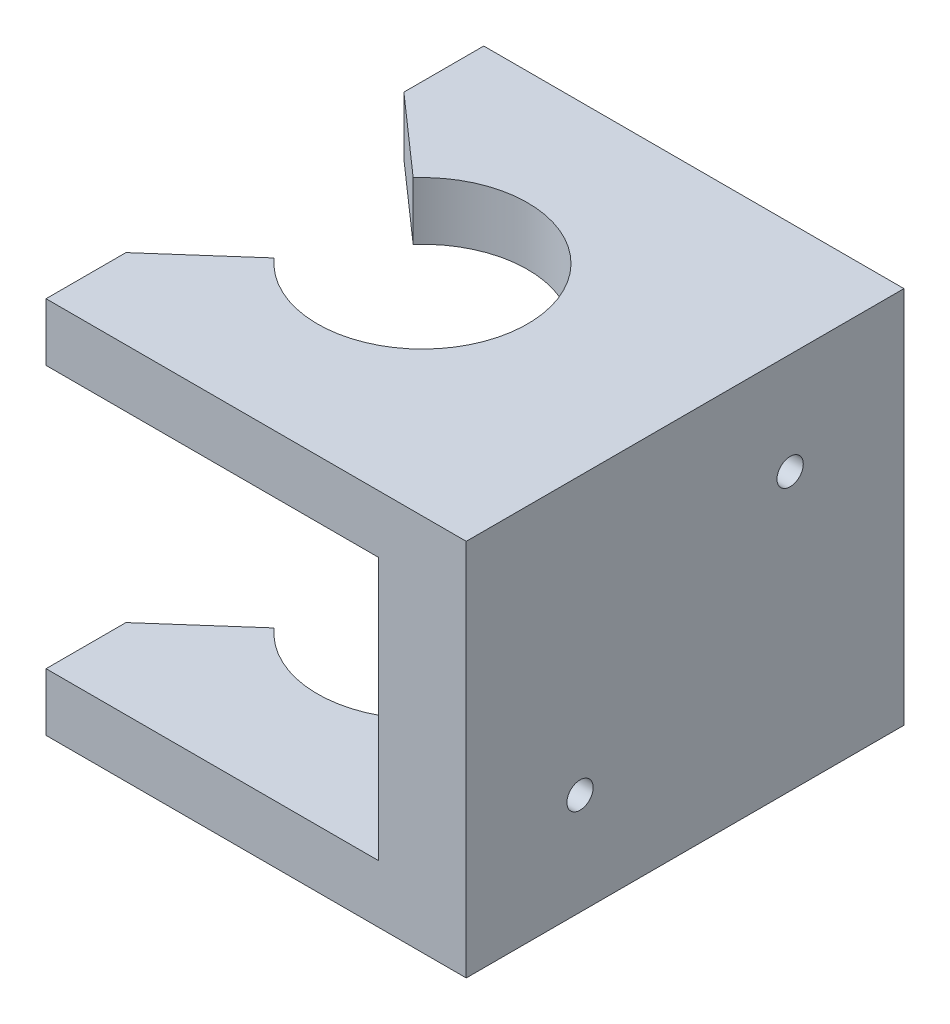
from build123d import *

# Parameters (mm, degrees)
BOSS_EXTRUDE1_DEPTH = 3.3
SKETCH3_W           = 5
SKETCH3_H           = 25
BOSS_EXTRUDE3_DEPTH = 15
BOSS_EXTRUDE4_DEPTH = 3.3
SKETCH5_R           = 0.75
CUT_EXTRUDE1_DEPTH  = 35.62383572


with BuildPart() as part:
    # Sketch2 → Boss-Extrude1 (new body)
    with BuildSketch(Plane(origin=(0, 0, 0), x_dir=(1, 0, 0), z_dir=(0, 1, 0))):
        with BuildLine():
            Line((15, -12.5), (-9, -12.5))
            Line((-9, -12.5), (-9, -7.937253933))
            Line((-9, -7.937253933), (-4.5, -3.968626967))
            ThreePointArc((-4.5, -3.968626967), (6, 0), (-4.5, 3.968626967))
            Line((-4.5, 3.968626967), (-9, 7.937253933))
            Line((-9, 7.937253933), (-9, 12.5))
            Line((-9, 12.5), (15, 12.5))
            Line((15, 12.5), (15, -12.5))
        make_face()
    extrude(amount=BOSS_EXTRUDE1_DEPTH)

    # Sketch3 → Boss-Extrude3 (add)
    with BuildSketch(Plane(origin=(0, 3.3, 0), x_dir=(1, 0, 0), z_dir=(0, 1, 0))):
        with Locations((12.5, 0)):
            Rectangle(SKETCH3_W, SKETCH3_H)
    extrude(amount=BOSS_EXTRUDE3_DEPTH)

    # Sketch4 → Boss-Extrude4 (add)
    with BuildSketch(Plane(origin=(0, 18.3, 0), x_dir=(1, 0, 0), z_dir=(0, 1, 0))):
        with BuildLine():
            Line((-9, -12.5), (15, -12.5))
            Line((15, -12.5), (15, 12.5))
            Line((15, 12.5), (-9, 12.5))
            Line((-9, 12.5), (-9, 7.937253933))
            Line((-9, 7.937253933), (-4.5, 3.968626967))
            ThreePointArc((-4.5, 3.968626967), (6, 0), (-4.5, -3.968626967))
            Line((-4.5, -3.968626967), (-9, -7.937253933))
            Line((-9, -7.937253933), (-9, -12.5))
        make_face()
    extrude(amount=BOSS_EXTRUDE4_DEPTH)

    # Sketch5 → Cut-Extrude1 (cut, through all)
    with BuildSketch(Plane(origin=(15, 0, 0), x_dir=(0, 0, -1), z_dir=(1, 0, 0))):
        with Locations((6, 15.8)):
            Circle(SKETCH5_R)
        with Locations((-6, 5.8)):
            Circle(SKETCH5_R)
    extrude(amount=-CUT_EXTRUDE1_DEPTH, mode=Mode.SUBTRACT)


solid = part.part
